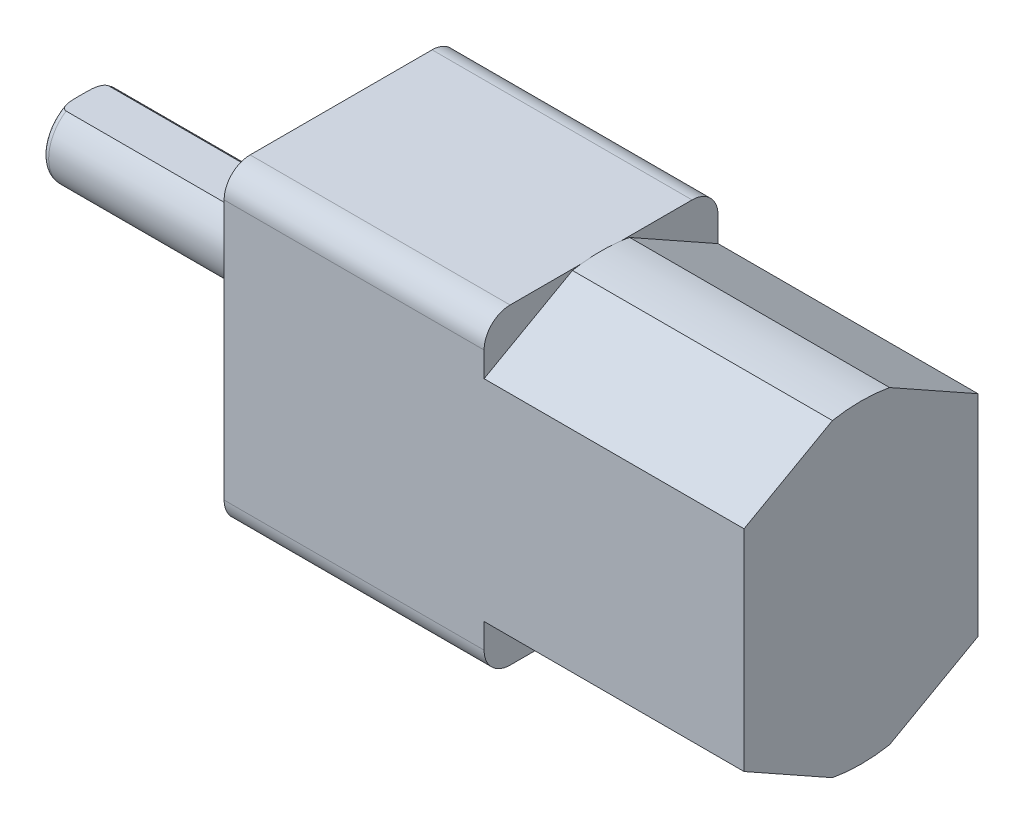
from build123d import *

# Parameters (mm, degrees)
SKETCH1_W           = 10
SKETCH1_H           = 12
SKETCH1_R           = 0.7
BOSS_EXTRUDE1_DEPTH = 9
BOSS_EXTRUDE2_DEPTH = 10
BOSS_EXTRUDE4_DEPTH = 0.7
BOSS_EXTRUDE5_DEPTH = 10
FILLET1_R           = 1
FILLET2_R           = 0.25


with BuildPart() as part:
    # Sketch1 → Boss-Extrude1 (new body)
    # profile 1 of 3: a face of its own
    with BuildSketch(Plane.XY):
        Rectangle(SKETCH1_W, SKETCH1_H)
        with Locations((0, 4.5)):
            Circle(SKETCH1_R, mode=Mode.SUBTRACT)
        with Locations((0, -4.5)):
            Circle(SKETCH1_R, mode=Mode.SUBTRACT)
    # profile 2 of 3: a face of its own
    with BuildSketch(Plane.XY):
        with Locations((0, -4.5)):
            Circle(SKETCH1_R)
    # profile 3 of 3: a face of its own
    with BuildSketch(Plane.XY):
        with Locations((0, 4.5)):
            Circle(SKETCH1_R)
    extrude(amount=-BOSS_EXTRUDE1_DEPTH)

    # Sketch2 → Boss-Extrude2 (add)
    with BuildSketch(Plane(origin=(5, 0, 0), x_dir=(0, 0, -1), z_dir=(1, 0, 0))):
        with BuildLine():
            Line((3.4, 5.949159605), (0, 4.043822449))
            Line((0, 4.043822449), (0, -4.043822449))
            Line((0, -4.043822449), (3.4, -5.949159605))
            ThreePointArc((3.4, -5.949159605), (3.561551285, -5.976772876), (3.723791265, -6))
            Line((3.723791265, -6), (5.276208735, -6))
            ThreePointArc((5.276208735, -6), (5.438448715, -5.976772876), (5.6, -5.949159605))
            Line((5.6, -5.949159605), (9, -4.043822449))
            Line((9, -4.043822449), (9, 4.043822449))
            Line((9, 4.043822449), (5.6, 5.949159605))
            ThreePointArc((5.6, 5.949159605), (5.438448715, 5.976772876), (5.276208735, 6))
            Line((5.276208735, 6), (3.723791265, 6))
            ThreePointArc((3.723791265, 6), (3.561551285, 5.976772876), (3.4, 5.949159605))
        make_face()
        with BuildLine():
            ThreePointArc((5.276208735, 6), (4.5, 6.05), (3.723791265, 6))
            Line((3.723791265, 6), (5.276208735, 6))
        make_face()
        with BuildLine():
            Line((5.276208735, -6), (3.723791265, -6))
            ThreePointArc((3.723791265, -6), (4.5, -6.05), (5.276208735, -6))
        make_face()
    extrude(amount=BOSS_EXTRUDE2_DEPTH)

    # Sketch4 → Boss-Extrude4 (add)
    with BuildSketch(Plane.ZY.offset(5)):
        with BuildLine():
            ThreePointArc((-6.5, 0), (-4.5, -2), (-2.5, 0))
            Line((-2.5, 0), (-3, 0))
            ThreePointArc((-3, 0), (-4.5, -1.5), (-6, 0))
            Line((-6, 0), (-6.5, 0))
        make_face()
        with BuildLine():
            Line((-3, 0), (-2.5, 0))
            ThreePointArc((-2.5, 0), (-4.5, 2), (-6.5, 0))
            Line((-6.5, 0), (-6, 0))
            ThreePointArc((-6, 0), (-5.821691018, 0.709318583), (-5.329156198, 1.25))
            ThreePointArc((-5.329156198, 1.25), (-4.5, 1.5), (-3.670843802, 1.25))
            ThreePointArc((-3.670843802, 1.25), (-3.178308982, 0.709318583), (-3, 0))
        make_face()
        with BuildLine():
            ThreePointArc((-6.5, 0), (-4.5, -2), (-2.5, 0))
            Line((-2.5, 0), (-3, 0))
            ThreePointArc((-3, 0), (-4.5, -1.5), (-6, 0))
            Line((-6, 0), (-6.5, 0))
        make_face()
        with BuildLine():
            Line((-3, 0), (-2.5, 0))
            ThreePointArc((-2.5, 0), (-4.5, 2), (-6.5, 0))
            Line((-6.5, 0), (-6, 0))
            ThreePointArc((-6, 0), (-5.821691018, 0.709318583), (-5.329156198, 1.25))
            ThreePointArc((-5.329156198, 1.25), (-4.5, 1.5), (-3.670843802, 1.25))
            ThreePointArc((-3.670843802, 1.25), (-3.178308982, 0.709318583), (-3, 0))
        make_face()
        with BuildLine():
            Line((-6, 0), (-3, 0))
            ThreePointArc((-3, 0), (-3.178308982, 0.709318583), (-3.670843802, 1.25))
            Line((-3.670843802, 1.25), (-5.329156198, 1.25))
            ThreePointArc((-5.329156198, 1.25), (-5.821691018, 0.709318583), (-6, 0))
        make_face()
        with BuildLine():
            Line((-5.329156198, 1.25), (-3.670843802, 1.25))
            ThreePointArc((-3.670843802, 1.25), (-4.5, 1.5), (-5.329156198, 1.25))
        make_face()
        with BuildLine():
            ThreePointArc((-6, 0), (-4.5, -1.5), (-3, 0))
            Line((-3, 0), (-6, 0))
        make_face()
    extrude(amount=BOSS_EXTRUDE4_DEPTH)

    # Sketch4<3> → Boss-Extrude5 (add)
    with BuildSketch(Plane.ZY.offset(5)):
        with BuildLine():
            Line((-6, 0), (-3, 0))
            ThreePointArc((-3, 0), (-3.178308982, 0.709318583), (-3.670843802, 1.25))
            Line((-3.670843802, 1.25), (-5.329156198, 1.25))
            ThreePointArc((-5.329156198, 1.25), (-5.821691018, 0.709318583), (-6, 0))
        make_face()
        with BuildLine():
            ThreePointArc((-6, 0), (-4.5, -1.5), (-3, 0))
            Line((-3, 0), (-6, 0))
        make_face()
    extrude(amount=BOSS_EXTRUDE5_DEPTH)

    # Fillet1
    fillet1_edges = [part.edges().sort_by_distance(p)[0] for p in [
        (0, 6, -9),
        (0, -6, -9),
        (0, 6, 0),
        (0, -6, 0),
    ]]
    fillet(fillet1_edges, radius=FILLET1_R)

    # Fillet2
    fillet2_edges = [part.edges().sort_by_distance(p)[0] for p in [
        (-15, -1.321691018, -5.209318583),
    ]]
    fillet(fillet2_edges, radius=FILLET2_R - 0.0001)  # a hair under: the kernel refuses the full size


solid = part.part
